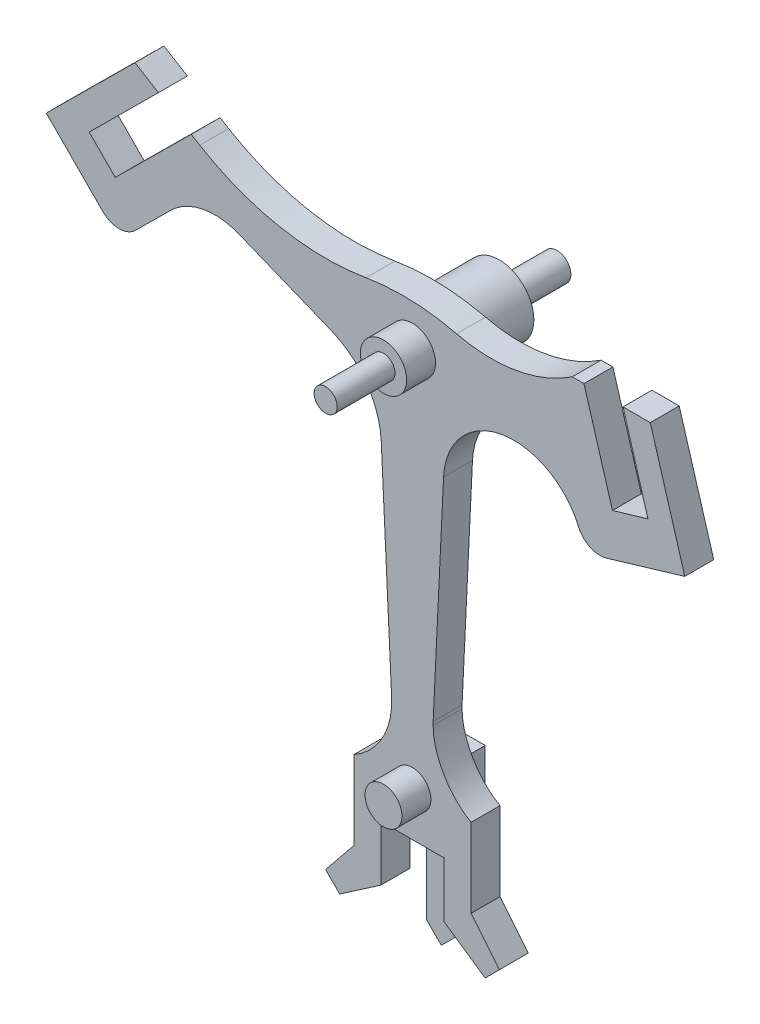
from build123d import *

# Parameters (mm, degrees)
BOSS_EXTRUDE1_DEPTH = 0.25
BOSS_EXTRUDE2_DEPTH = 0.25
CUT_EXTRUDE1_DEPTH  = 6.593003707
CUT_EXTRUDE2_DEPTH  = 6.593003707
DRAFT1_ANGLE        = 34.486089424
DRAFT2_ANGLE        = 50.980599525
DRAFT3_ANGLE        = 16.594713156
DRAFT4_ANGLE        = -16.43287546
DRAFT5_ANGLE        = 50.980599525
SKETCH5_W           = 0.16
SKETCH5_H           = 0.25
CHAMFER1_SIZE       = 0.063800239
FILLET1_R           = 0.2
FILLET2_R           = 0.544507155
FILLET3_R           = 0.697211686


with BuildPart() as part:
    # Sketch1 → Boss-Extrude1 (new body)
    with BuildSketch(Plane(origin=(0, 0, -0.125), x_dir=(-1, 0, 0), z_dir=(0, 0, -1))):
        with BuildLine():
            Line((-0.272408935, -3.667083787), (0.272408935, -3.667083787))
            Line((0.272408935, -3.667083787), (0.272408935, -4.143899332))
            Line((0.272408935, -4.143899332), (0.873103994, -4.143899332))
            Line((0.873103994, -4.143899332), (1.051569895, -3.965092957))
            Line((1.051569895, -3.965092957), (0.506698534, -3.965092957))
            Line((0.506698534, -3.965092957), (0.506698534, -3.283729886))
            ThreePointArc((0.506698534, -3.283729886), (0.259096573, -3.03452958), (0.179431493, -2.692387798))
            Line((0.179431493, -2.692387798), (0.290781228, -0.37153351))
            Line((0.290781228, -0.37153351), (1.835162636, 0.252738405))
            Line((1.835162636, 0.252738405), (2.536874566, -0.443310952))
            Line((2.536874566, -0.443310952), (3.165693689, 0.190623805))
            Line((3.165693689, 0.190623805), (2.398976763, 0.95115359))
            Line((2.398976763, 0.95115359), (1.838429548, 0.613387961))
            ThreePointArc((1.838429548, 0.613387961), (0.12624114, 0.405056697), (-1.168932242, 1.544142722))
            Line((-1.168932242, 1.544142722), (-1.729686411, -0.337503893))
            Line((-1.729686411, -0.337503893), (-1.821011369, -0.310568547))
            Line((-1.821011369, -0.310568547), (-1.821011369, 0.484030911))
            Line((-1.821011369, 0.484030911), (-2.056654947, 0.484030911))
            Line((-2.056654947, 0.484030911), (-2.056654947, -0.607371456))
            Line((-2.056654947, -0.607371456), (-1.482657454, -0.77842987))
            ThreePointArc((-1.482657454, -0.77842987), (-0.858095498, -0.237884247), (-0.269395252, -0.817279818))
            Line((-0.269395252, -0.817279818), (-0.179431493, -2.692387798))
            add(Edge.make_bspline(
                [(-0.179431493, -2.723199698), (-0.179183719, -2.712865075), (-0.179186918, -2.702588974), (-0.179431493, -2.692387798)],
                knots=[0, 0, 0, 0, 1, 1, 1, 1], degree=3))
            add(Edge.make_bspline(
                [(-0.507437255, -3.283729886), (-0.319927849, -3.178374639), (-0.179431493, -2.941093516), (-0.179431493, -2.723199698)],
                knots=[0, 0, 0, 0, 1, 1, 1, 1], degree=3))
            Line((-0.507437255, -3.283729886), (-0.507437255, -3.965092957))
            Line((-0.507437255, -3.965092957), (-1.051569895, -3.965092957))
            Line((-1.051569895, -3.965092957), (-0.628774335, -4.388695119))
            Line((-0.628774335, -4.388695119), (-0.272408935, -4.143899332))
            Line((-0.272408935, -4.143899332), (-0.272408935, -3.667083787))
        make_face()
    extrude(amount=-BOSS_EXTRUDE1_DEPTH)

    # Sketch2 → Boss-Extrude2 (add)
    with BuildSketch(Plane(origin=(0, 0, -0.125), x_dir=(-1, 0, 0), z_dir=(0, 0, -1))):
        Polygon((-0.129661741, -3.146789365), (0.129661741, -3.146789365), (0.129661741, -4.454012909), (0, -4.58367465), (-0.129661741, -4.454012909), align=None)
    extrude(amount=BOSS_EXTRUDE2_DEPTH)

    # Sketch3 → Cut-Extrude1 (cut, through all)
    with BuildSketch(Plane.XY.offset(0.125)):
        Polygon((-2.195377886, 0.828472215), (-2.794411885, 0.234272214), (-2.56905624, 0.007083233), (-1.912701402, 0.658141514), align=None)
    extrude(amount=-CUT_EXTRUDE1_DEPTH, mode=Mode.SUBTRACT)

    # Sketch4 → Cut-Extrude2 (cut, through all)
    with BuildSketch(Plane.XY.offset(0.125)):
        with BuildLine():
            Line((1.465134235, 0.550217916), (1.168932242, 1.544142722))
            ThreePointArc((1.168932242, 1.544142722), (0.534119283, 0.746589992), (-0.400581525, 0.339880942))
            ThreePointArc((-0.400581525, 0.339880942), (-0.007751749, 0.365487208), (0.382199804, 0.311554845))
            ThreePointArc((0.382199804, 0.311554845), (0.951331817, 0.305357276), (1.465134235, 0.550217916))
        make_face()
    extrude(amount=-CUT_EXTRUDE2_DEPTH, mode=Mode.SUBTRACT)

    # Draft1
    draft1_faces = [part.faces().sort_by_distance(p)[0] for p in [
        (-0.572756465, -4.143899332, 0),
    ]]
    draft(draft1_faces, Plane(origin=(-0.272408935, -3.667083787, 0.125), x_dir=(0, 0, 1), z_dir=(1, 0, 0)), DRAFT1_ANGLE)

    # Draft2
    draft2_faces = [part.faces().sort_by_distance(p)[0] for p in [
        (-0.779134215, -3.965092957, 0),
    ]]
    draft(draft2_faces, Plane(origin=(-0.506698534, -3.965092957, 0.125), x_dir=(0, -1, 0), z_dir=(-1, 0, 0)), DRAFT2_ANGLE)

    # Draft3
    draft3_faces = [part.faces().sort_by_distance(p)[0] for p in [
        (2.056654947, -0.061670272, 0),
    ]]
    draft(draft3_faces, Plane(origin=(1.821011369, 0.484030911, 0.125), x_dir=(1, 0, 0), z_dir=(0, 1, 0)), DRAFT3_ANGLE)

    # Draft4
    draft4_faces = [part.faces().sort_by_distance(p)[0] for p in [
        (1.821011369, 0.086731182, 0),
    ]]
    draft(draft4_faces, Plane(origin=(1.821011369, 0.484030911, 0.125), x_dir=(1, 0, 0), z_dir=(0, 1, 0)), DRAFT4_ANGLE)

    # Draft5
    draft5_faces = [part.faces().sort_by_distance(p)[0] for p in [
        (0.779503575, -3.965092957, 0),
    ]]
    draft(draft5_faces, Plane(origin=(0.507437255, -3.283729886, 0.125), x_dir=(0, 1, 0), z_dir=(1, 0, 0)), DRAFT5_ANGLE)

    # Sketch5 → Revolve1 (revolve)
    with BuildSketch(Plane.XZ.offset(3.286499627), mode=Mode.PRIVATE) as revolve1_sk:
        with Locations((0.08, 0.25)):
            Rectangle(SKETCH5_W, SKETCH5_H)
    revolve(revolve1_sk.sketch.rotate(Axis((0, -3.286499627, 0.375), (0, 0, -1)), 180), axis=Axis((0, -3.286499627, 0.375), (0, 0, -1)))

    # Sketch6 → Revolve2 (revolve)
    with BuildSketch(Plane.XZ, mode=Mode.PRIVATE) as revolve2_sk:
        Polygon((0.1, 0.875), (0, 0.875), (0, 0.125), (0.2, 0.125), (0.2, 0.375), (0.1, 0.375), align=None)
    revolve(revolve2_sk.sketch.rotate(Axis((0, 0, 0.875), (0, 0, -1)), 180), axis=Axis((0, 0, 0.875), (0, 0, -1)))

    # Sketch7 → Revolve3 (revolve)
    with BuildSketch(Plane(origin=(0, 0, 0), x_dir=(1, 0, 0), z_dir=(0, 1, 0))):
        Polygon((0.12, 1.125), (0, 1.125), (0, 0.125), (0.3, 0.125), (0.3, 0.625), (0.12, 0.625), align=None)
    revolve(axis=Axis((0, 0, -1.125), (0, 0, 1)))

    # Chamfer1
    # the kernel refuses this chamfer: 0.098147605, 0.063800239 mm, written as the material it takes off along each edge
    with BuildSketch(Plane(origin=(1.465134235, 0.550217916, 0.391937228), x_dir=(0.28559993905101894, -0.9583489316600996, 0), z_dir=(0, 0, -1))) as chamfer1_piece_1:
        with BuildLine():
            Line((CHAMFER1_SIZE * 1.00000000412, 0), (0.034717393, 0.097589357))
            ThreePointArc((0.034717393, 0.097589357), (0.018892926, 0.049933601), (0, 0))
            Line((0, 0), (CHAMFER1_SIZE * 1.00000000412, 0))
        make_face()
    extrude(amount=0.783874457, mode=Mode.SUBTRACT)

    # Fillet1
    fillet1_edges = [part.edges().sort_by_distance(p)[0] for p in [
        (1.482657454, -0.77842987, 0),
        (-2.536874566, -0.443310952, 0),
    ]]
    fillet(fillet1_edges, radius=FILLET1_R)

    # Fillet2
    fillet2_edges = [part.edges().sort_by_distance(p)[0] for p in [
        (-1.835162636, 0.252738405, 0),
    ]]
    fillet(fillet2_edges, radius=FILLET2_R)

    # Fillet3
    fillet3_edges = [part.edges().sort_by_distance(p)[0] for p in [
        (-0.290781228, -0.37153351, 0),
    ]]
    fillet(fillet3_edges, radius=FILLET3_R)


solid = part.part
